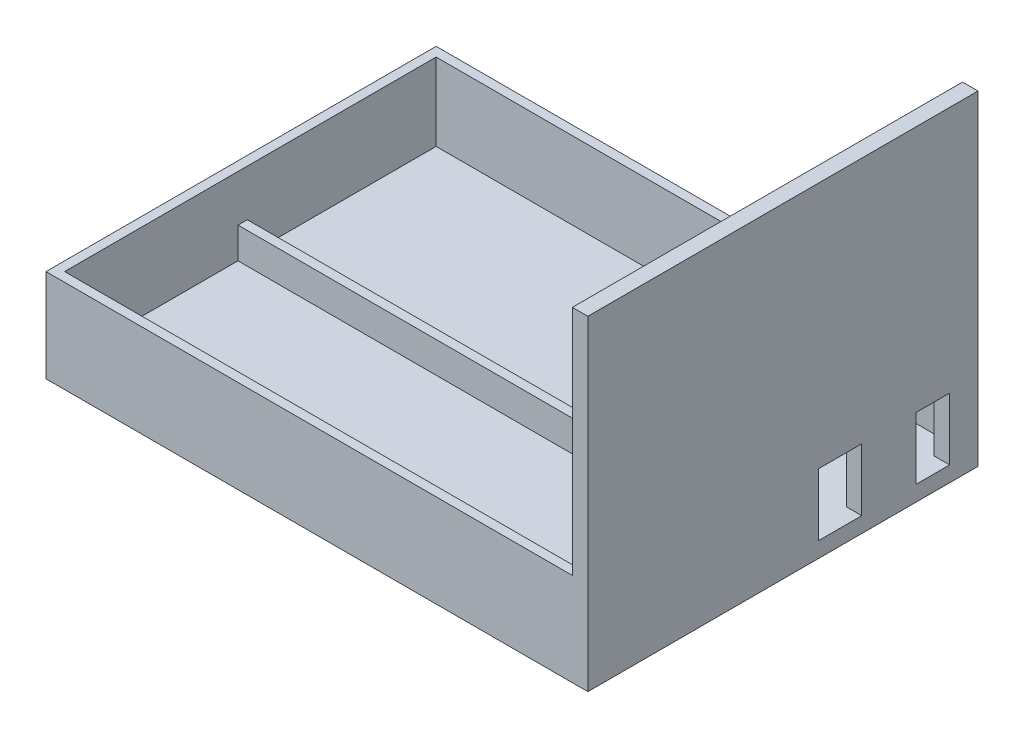
from build123d import *

# Parameters (mm, degrees)
SZKIC1_W                    = 175
SZKIC1_H                    = 126
DODANIE_WYCI_GNI_CIE1_DEPTH = 5
SZKIC2_W                    = 3
SZKIC2_H                    = 126
DODANIE_WYCI_GNI_CIE2_DEPTH = 25
SZKIC3_W                    = 5
SZKIC3_H                    = 126
DODANIE_WYCI_GNI_CIE3_DEPTH = 100
SZKIC4_W                    = 167
SZKIC4_H                    = 3
DODANIE_WYCI_GNI_CIE4_DEPTH = 25
SZKIC5_W                    = 167
SZKIC5_H                    = 3
DODANIE_WYCI_GNI_CIE5_DEPTH = 25
WYTNIJ_WYCI_GNI_CIE1_REACH  = 215.586
SZKIC7_W                    = 14
SZKIC7_H                    = 20.1
WYTNIJ_WYCI_GNI_CIE2_REACH  = 215.586
SZKIC8_W                    = 10.9
SZKIC8_H                    = 20.1
SZKIC10_W                   = 167
SZKIC10_H                   = 3
DODANIE_WYCI_GNI_CIE6_DEPTH = 10


with BuildPart() as part:
    # Szkic1 → Dodanie-wyciągnięcie1 (new body)
    with BuildSketch(Plane(origin=(0, 0, 0), x_dir=(1, 0, 0), z_dir=(0, 1, 0))):
        Rectangle(SZKIC1_W, SZKIC1_H)
    extrude(amount=DODANIE_WYCI_GNI_CIE1_DEPTH)

    # Szkic2 → Dodanie-wyciągnięcie2 (add)
    with BuildSketch(Plane(origin=(0, 5, 0), x_dir=(1, 0, 0), z_dir=(0, 1, 0))):
        with Locations((-86, 0)):
            Rectangle(SZKIC2_W, SZKIC2_H)
    extrude(amount=DODANIE_WYCI_GNI_CIE2_DEPTH)

    # Szkic3 → Dodanie-wyciągnięcie3 (add)
    with BuildSketch(Plane(origin=(0, 5, 0), x_dir=(1, 0, 0), z_dir=(0, 1, 0))):
        with Locations((85, 0)):
            Rectangle(SZKIC3_W, SZKIC3_H)
    extrude(amount=DODANIE_WYCI_GNI_CIE3_DEPTH)

    # Szkic4 → Dodanie-wyciągnięcie4 (add)
    with BuildSketch(Plane(origin=(0, 5, 0), x_dir=(1, 0, 0), z_dir=(0, 1, 0))):
        with Locations((-1, -61.5)):
            Rectangle(SZKIC4_W, SZKIC4_H)
    extrude(amount=DODANIE_WYCI_GNI_CIE4_DEPTH)

    # Szkic5 → Dodanie-wyciągnięcie5 (add)
    with BuildSketch(Plane(origin=(0, 5, 0), x_dir=(1, 0, 0), z_dir=(0, 1, 0))):
        with Locations((-1, 61.5)):
            Rectangle(SZKIC5_W, SZKIC5_H)
    extrude(amount=DODANIE_WYCI_GNI_CIE5_DEPTH)

    # Szkic7 → Wytnij-wyciągnięcie1 (cut, up to next)
    with BuildSketch(Plane(origin=(87.5, 0, 0), x_dir=(0, 0, -1), z_dir=(1, 0, 0)), mode=Mode.PRIVATE) as wytnij_wyci_gni_cie1_sk1:
        with Locations((18.45, 15.05)):
            Rectangle(SZKIC7_W, SZKIC7_H)
    wytnij_wyci_gni_cie1_tool1 = extrude(wytnij_wyci_gni_cie1_sk1.sketch, amount=-WYTNIJ_WYCI_GNI_CIE1_REACH, mode=Mode.PRIVATE) & part.part
    add(wytnij_wyci_gni_cie1_tool1.solids().sort_by_distance((87.5, 15.05, -18.45))[0], mode=Mode.SUBTRACT)

    # Szkic8 → Wytnij-wyciągnięcie2 (cut, up to next)
    with BuildSketch(Plane(origin=(87.5, 0, 0), x_dir=(0, 0, -1), z_dir=(1, 0, 0)), mode=Mode.PRIVATE) as wytnij_wyci_gni_cie2_sk1:
        with Locations((48.4, 15.05)):
            Rectangle(SZKIC8_W, SZKIC8_H)
    wytnij_wyci_gni_cie2_tool1 = extrude(wytnij_wyci_gni_cie2_sk1.sketch, amount=-WYTNIJ_WYCI_GNI_CIE2_REACH, mode=Mode.PRIVATE) & part.part
    add(wytnij_wyci_gni_cie2_tool1.solids().sort_by_distance((87.5, 15.05, -48.4))[0], mode=Mode.SUBTRACT)

    # Szkic10 → Dodanie-wyciągnięcie6 (add)
    with BuildSketch(Plane(origin=(0, 5, 0), x_dir=(1, 0, 0), z_dir=(0, 1, 0))):
        with Locations((-1, -2.5)):
            Rectangle(SZKIC10_W, SZKIC10_H)
    extrude(amount=DODANIE_WYCI_GNI_CIE6_DEPTH)


solid = part.part
